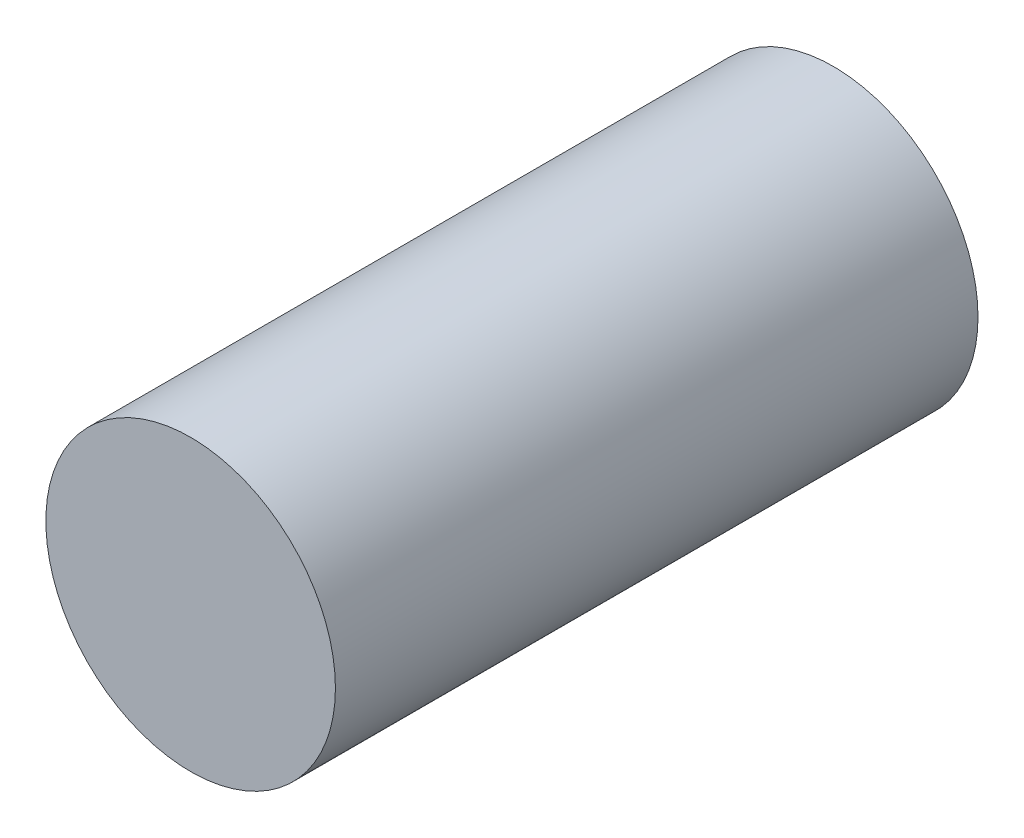
from build123d import *

# Parameters (mm, degrees)
SKETCH1_R          = 1330.787079442
NACELLE_BODY_DEPTH = 5906.114982768


with BuildPart() as part:
    # Sketch1 → Nacelle body (new body)
    with BuildSketch(Plane.XY):
        Circle(SKETCH1_R)
    extrude(amount=NACELLE_BODY_DEPTH)


solid = part.part
